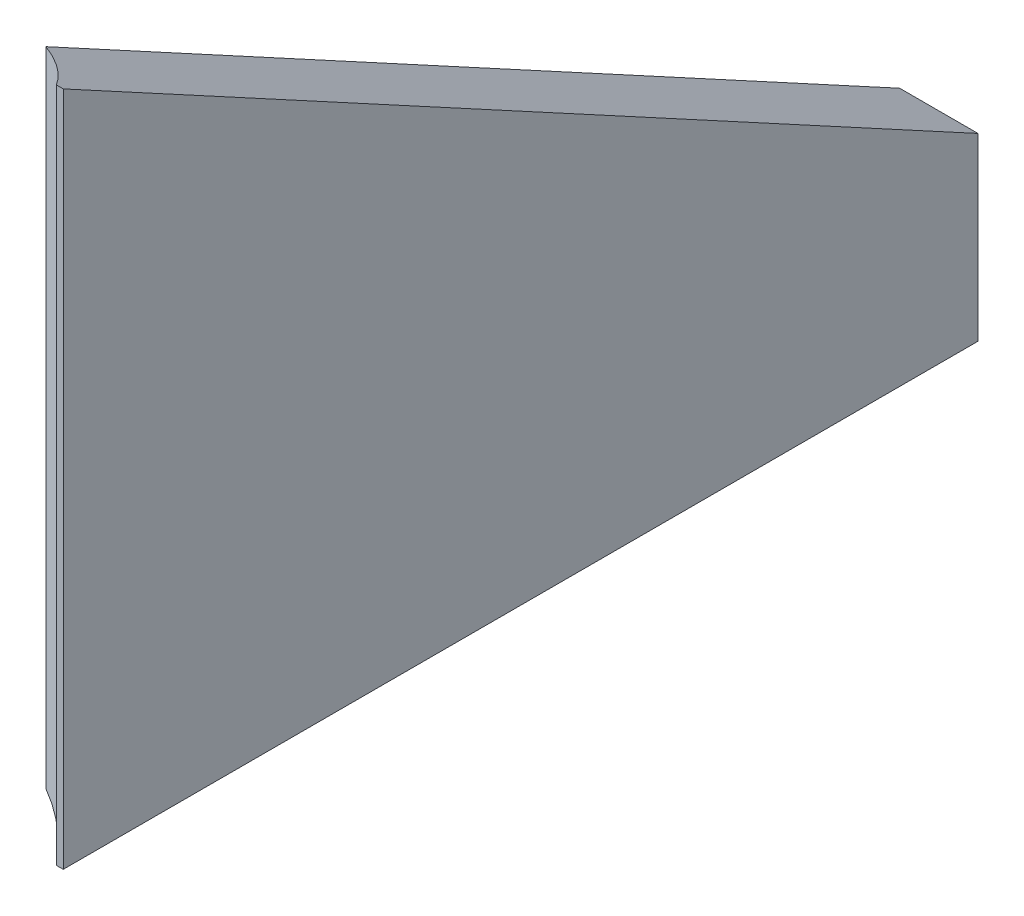
from build123d import *

# Parameters (mm, degrees)
BOSS_EXTRUDE1_DEPTH = 3.77
FILLET1_R           = 0.2
CAVITY1_DEPTH       = 32.53
CUT_EXTRUDE1_DEPTH  = 10


# Read off the part's stored shape, not the designer's step: Cavity1
with BuildPart() as part:
    # Sketch1 → Boss-Extrude1 (new body)
    with BuildSketch(Plane(origin=(0, 0, 0), x_dir=(0, 0, -1), z_dir=(1, 0, 0))):
        Polygon((0, 0), (60, 0), (0, 32.53), align=None)
    extrude(amount=BOSS_EXTRUDE1_DEPTH)

    # Fillet1
    fillet1_edges = [part.edges().sort_by_distance(p)[0] for p in [
        (1.885, 0, -60),
    ]]
    fillet(fillet1_edges, radius=FILLET1_R)

    # Cavity1 outline → Cavity1 (cut)
    with BuildSketch(Plane(origin=(0, 0, 0), x_dir=(1, 0, 0), z_dir=(0, 1, 0))):
        with BuildLine():
            Line((0, 0), (3.434066763, 0))
            ThreePointArc((3.434066763, 0), (1.851918424, 1.627143202), (0, 2.939083185))
            Line((0, 2.939083185), (0, 0))
        make_face()
    extrude(amount=CAVITY1_DEPTH, mode=Mode.SUBTRACT)

    # Sketch2 → Cut-Extrude1 (cut)
    with BuildSketch(Plane.ZY):
        Polygon((-44.024699242, 0), (-44.024699242, 8.661275561), (-59.306815437, 0.375821564), (-59.211490846, 0), align=None)
    extrude(amount=-CUT_EXTRUDE1_DEPTH, mode=Mode.SUBTRACT)


with BuildPart() as body_2:
    # of the pieces the cut leaves, the one that is kept (cut_extrude1_keep)
    add(part.part.solids().sort_by_distance((0, 0, -2.939083185))[0])


solid = body_2.part
